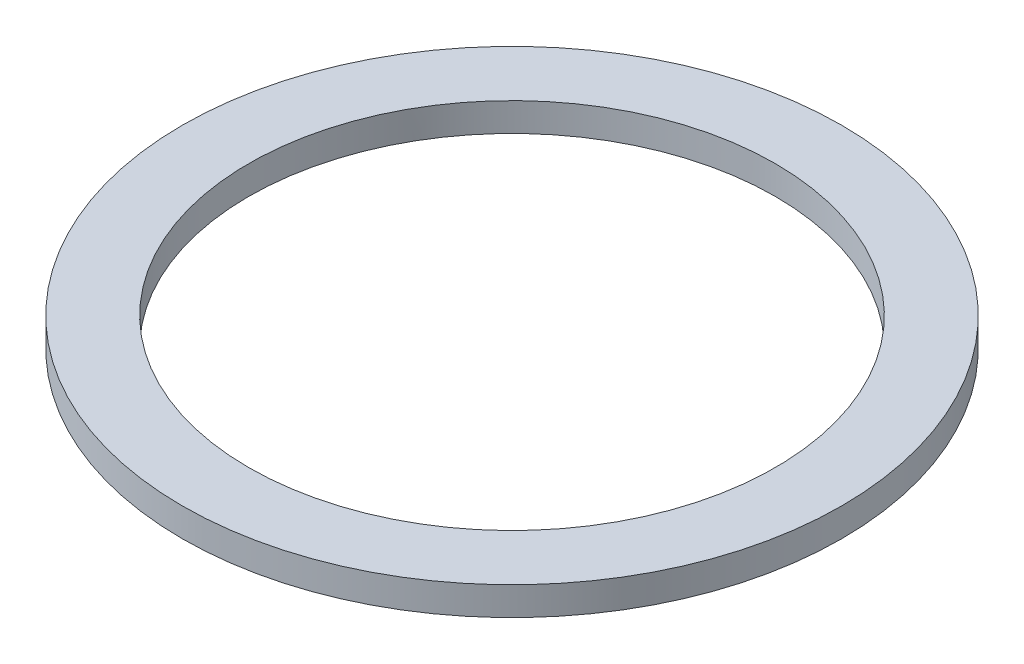
from build123d import *

# Parameters (mm, degrees)
BOSS_EXTRUDE1_START = -4
BOSS_EXTRUDE1_DEPTH = 4
CIRPATTERN2_COUNT   = 2
CIRPATTERN2_ANGLE   = 55
CUT_EXTRUDE1_DEPTH  = 9
FILLET1_R           = 14


with BuildPart() as part:
    # Sketch1 → Revolve1 (revolve)
    with BuildSketch(Plane.XY, mode=Mode.PRIVATE) as revolve1_sk:
        with BuildLine():
            Line((111, 12), (139, 12))
            Line((139, 12), (139, 0))
            Line((139, 0), (132.937253933, 0))
            ThreePointArc((132.937253933, 0), (125, 7), (117.062746067, 0))
            Line((117.062746067, 0), (111, 0))
            Line((111, 0), (111, 12))
        make_face()
    revolve(revolve1_sk.sketch.rotate(Axis((0, 4.511025306, 0), (0, 1, 0)), 90), axis=Axis((0, 4.511025306, 0), (0, 1, 0)))

    # Sketch2 → Boss-Extrude1 (add)
    with BuildSketch(Plane.XZ.offset(BOSS_EXTRUDE1_START)):
        with BuildLine():
            Line((82.734356473, 57.931220071), (90.925876916, 63.666984435))
            ThreePointArc((90.925876916, 63.666984435), (93.616450485, 59.640256526), (96.12881982, 55.5))
            Line((96.12881982, 55.5), (87.468565782, 50.5))
            ThreePointArc((87.468565782, 50.5), (85.182536027, 54.267260443), (82.734356473, 57.931220071))
        make_face()
    boss_extrude1 = extrude(amount=BOSS_EXTRUDE1_DEPTH)

    # CirPattern2: Boss-Extrude1 ×2 about axis
    cirpattern2_axis = Axis((0, 0, 0), (0, -1, 0))
    for i in range(1, CIRPATTERN2_COUNT):
        add(boss_extrude1.rotate(cirpattern2_axis, i * CIRPATTERN2_ANGLE / (CIRPATTERN2_COUNT - 1)))

    # Sketch5 → Cut-Extrude1 (cut)
    with BuildSketch(Plane.XZ):
        Polygon((-75.247171131, 81.601858047), (-79.64873019, 83.973835671), (-78.937136903, 85.294303389), (-74.070295271, 82.671587371), (-71.895448203, 81.499573429), (-72.60704149, 80.179105712), align=None)
    extrude(amount=-CUT_EXTRUDE1_DEPTH, mode=Mode.SUBTRACT)

    # Fillet1
    # the kernel refuses this fillet: 14 mm, written as the material it takes off along each edge
    with BuildSketch(Plane(origin=(0, 4, 0), x_dir=(0.9607578733888479, 0, 0.2773883716404464), z_dir=(0.2773883716404464, 0, -0.9607578733888479))) as fillet1_piece_1:
        with BuildLine():
            CenterArc((110.797958971, 14), FILLET1_R, 225.584691403, 44.415308597)
            Line((110.797958971, 0), (110.797958971, -0.28))
            Line((110.797958971, -0.28), (101, -0.28))
            Line((101, -0.28), (100.72, 0))
            ThreePointArc((100.72, 0), (100.72, 2), (100.804040821, 3.8))
            Line((100.804040821, 3.8), (101, 4))
        make_face()
    revolve(axis=Axis((0, 4, 0), (0, -1, 0)), revolution_arc=32.79120756, mode=Mode.SUBTRACT)
    with BuildSketch(Plane(origin=(0, 4, 0), x_dir=(0.32384482552331617, 0, 0.9461102097439669), z_dir=(0.9461102097439669, 0, -0.32384482552331617))) as fillet1_piece_2:
        with BuildLine():
            CenterArc((110.797958971, 14), FILLET1_R, 225.584691403, 44.415308597)
            Line((110.797958971, 0), (110.797958971, -0.28))
            Line((110.797958971, -0.28), (101, -0.28))
            Line((101, -0.28), (100.72, 0))
            ThreePointArc((100.72, 0), (100.72, 2), (100.804040821, 3.8))
            Line((100.804040821, 3.8), (101, 4))
        make_face()
    revolve(axis=Axis((0, 4, 0), (0, -1, 0)), revolution_arc=32.79120756, mode=Mode.SUBTRACT)


solid = part.part
